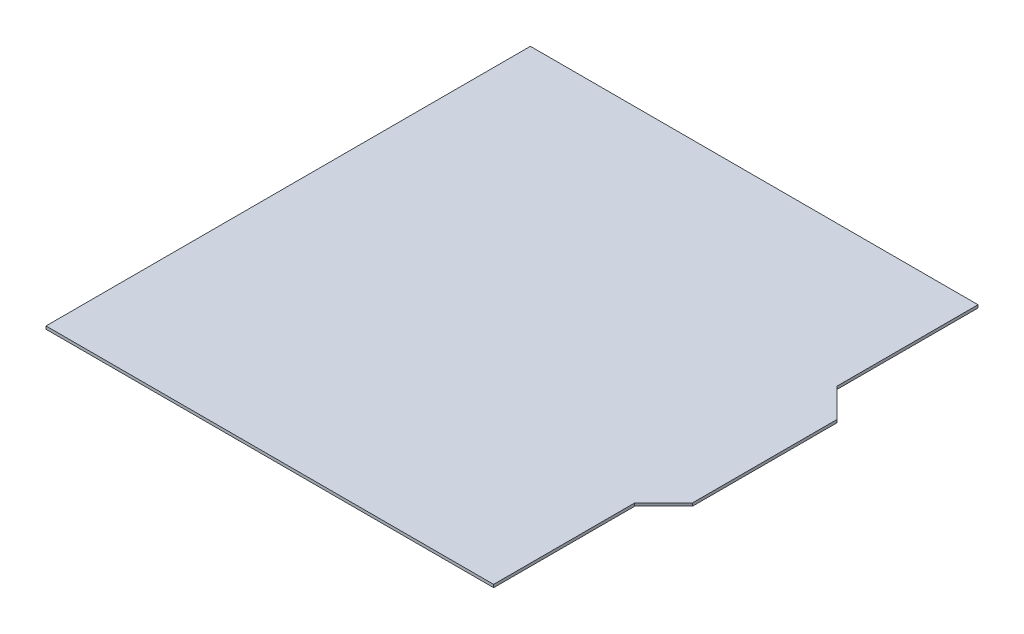
from build123d import *

# Parameters (mm, degrees)
BASE_FLANGE1_DEPTH = 2


# Sheet-metal steps are written as plain solids
with BuildPart() as part:
    # Sketch1 → Base-Flange1 (new body)
    with BuildSketch(Plane(origin=(0, 0, 0), x_dir=(1, 0, 0), z_dir=(0, 1, 0))):
        Polygon((-155, -167.726093983), (155, -167.726093983), (155, -70), (175, -50), (175, 50), (155, 70), (155, 167.726093983), (-155, 167.726093983), align=None)
    extrude(amount=-BASE_FLANGE1_DEPTH)


solid = part.part
